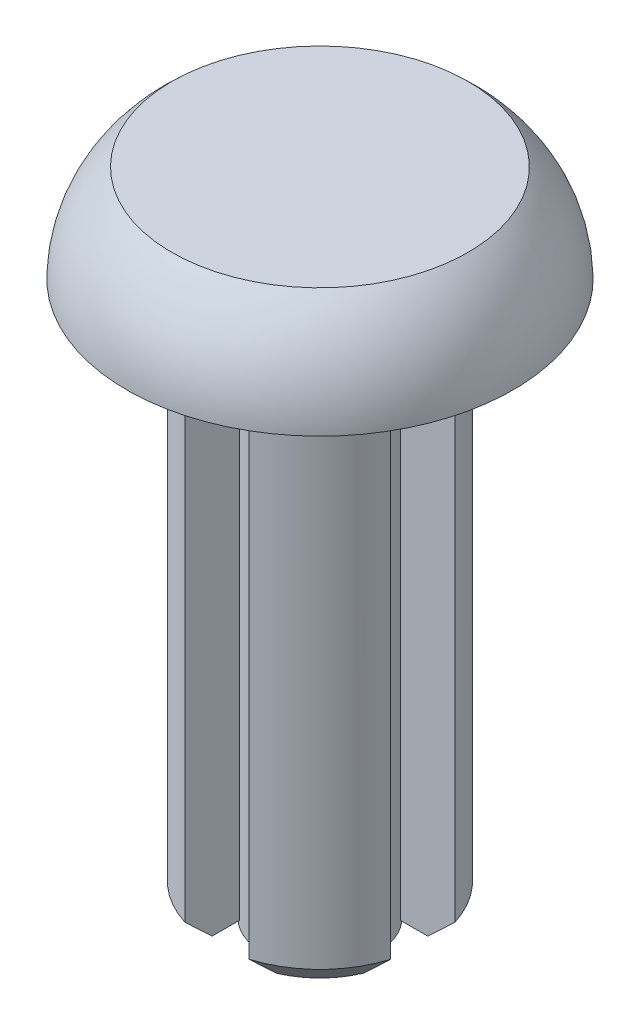
from build123d import *
from build123d.topology import SkipClean

# Parameters (mm, degrees)
SKETCH2_W          = 0.98425
SKETCH2_H          = 0.635005697
CUT_EXTRUDE1_DEPTH = 10.16
CIRPATTERN1_COUNT  = 4
CHAMFER1_SIZE      = 0.508


with BuildPart() as part:
    # Sketch1 → Revolve1 (revolve)
    with BuildSketch(Plane.XY):
        with BuildLine():
            Line((-2.12725, 0.905), (-2.12725, -11.4394))
            Line((-2.12725, -11.4394), (0, -11.4394))
            Line((0, -11.4394), (0, 1.905))
            Line((0, 1.905), (-2.921, 1.905))
            ThreePointArc((-2.921, 1.905), (-3.565448038, 1.045809085), (-3.81, 0))
            Line((-3.81, 0), (-2.810259853, -0.022795573))
            ThreePointArc((-2.810259853, -0.022795573), (-2.722709553, 0.465976492), (-2.49071484, 0.905))
            Line((-2.49071484, 0.905), (-2.12725, 0.905))
        make_face()
    revolve(axis=Axis((0, 1.905, 0), (0, -1, 0)))

    # Sketch2 → Cut-Revolve1 (revolve, cut)
    with BuildSketch(Plane(origin=(0, 0, 0), x_dir=(0, 0, -1), z_dir=(1, 0, 0))):
        with Locations((1.635125, -11.121897152)):
            Rectangle(SKETCH2_W, SKETCH2_H)
    revolve(axis=Axis((0, -11.4394, 0), (0, 1, 0)), mode=Mode.SUBTRACT)

    # Sketch3 → Cut-Extrude1 (cut)
    with BuildSketch(Plane.XZ.offset(10.804394303)):
        with BuildLine():
            Line((0.635, 0.950380976), (0.635, 2.030262929))
            ThreePointArc((0.635, 2.030262929), (0, 2.12725), (-0.635, 2.030262929))
            Line((-0.635, 2.030262929), (-0.635, 0.950380976))
            ThreePointArc((-0.635, 0.950380976), (0, 1.143), (0.635, 0.950380976))
        make_face()
    cut_extrude1 = extrude(amount=-CUT_EXTRUDE1_DEPTH, mode=Mode.SUBTRACT)

    # CirPattern1: Cut-Extrude1 ×4 about axis
    with SkipClean():  # the faces are left unmerged after this step: merging them gives an invalid solid
        cirpattern1_axis = Axis((0, 1.905, 0), (0, 1, 0))
        for i in range(1, CIRPATTERN1_COUNT):
            add(cut_extrude1.rotate(cirpattern1_axis, i * 360 / CIRPATTERN1_COUNT), mode=Mode.SUBTRACT)

    # Chamfer1
    chamfer1_edges = [part.edges().sort_by_distance(p)[0] for p in [
        (-1.5041929, -10.804394303, -1.5041929),
        (1.5041929, -10.804394303, -1.5041929),
        (-1.5041929, -10.804394303, 1.5041929),
        (1.5041929, -10.804394303, 1.5041929),
        (0, -11.4394, 1.143),
    ]]
    chamfer(chamfer1_edges, length=CHAMFER1_SIZE)


solid = part.part
